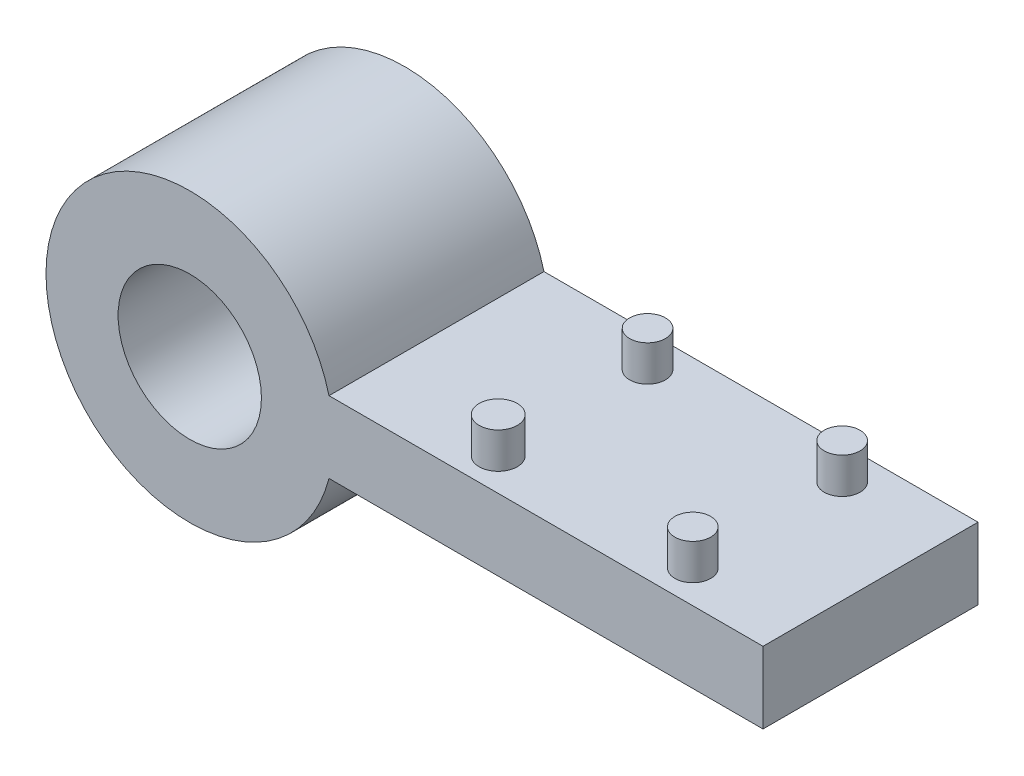
from build123d import *

# Parameters (mm, degrees)
SKETCH1_W           = 80
SKETCH1_H           = 30
BOSS_EXTRUDE1_DEPTH = 10
SKETCH2_R           = 20.062945277
BOSS_EXTRUDE2_DEPTH = 30
SKETCH4_R           = 10
CUT_EXTRUDE1_DEPTH  = 69.909497643
SKETCH5_R           = 2.5
SKETCH5_R_2         = 2.658706029
BOSS_EXTRUDE3_DEPTH = 5


with BuildPart() as part:
    # Sketch1 → Boss-Extrude1 (new body)
    with BuildSketch(Plane(origin=(0, 0, -0.415911031), x_dir=(1, 0, 0), z_dir=(0, 1, 0))):
        with Locations((16.748283141, -10.801087703)):
            Rectangle(SKETCH1_W, SKETCH1_H)
    extrude(amount=BOSS_EXTRUDE1_DEPTH)

    # Sketch2 → Boss-Extrude2 (add)
    with BuildSketch(Plane.XY.offset(25.385176672)):
        with Locations((-23.251716859, 5)):
            Circle(SKETCH2_R)
    extrude(amount=-BOSS_EXTRUDE2_DEPTH)

    # Sketch4 → Cut-Extrude1 (cut, through all)
    with BuildSketch(Plane.XY.offset(25.385176672)):
        with Locations((-23.251716859, 5)):
            Circle(SKETCH4_R)
    extrude(amount=-CUT_EXTRUDE1_DEPTH, mode=Mode.SUBTRACT)

    # Sketch5 → Boss-Extrude3 (add)
    with BuildSketch(Plane(origin=(0, 10, 0), x_dir=(1, 0, 0), z_dir=(0, 1, 0))):
        with Locations((42.40363046, -20.841518963)):
            Circle(SKETCH5_R)
        with Locations((15.248353466, -20.841518963)):
            Circle(SKETCH5_R_2)
        with Locations((15.248353466, 0)):
            Circle(SKETCH5_R)
        with Locations((42.40363046, 0)):
            Circle(SKETCH5_R)
    extrude(amount=BOSS_EXTRUDE3_DEPTH)


solid = part.part
